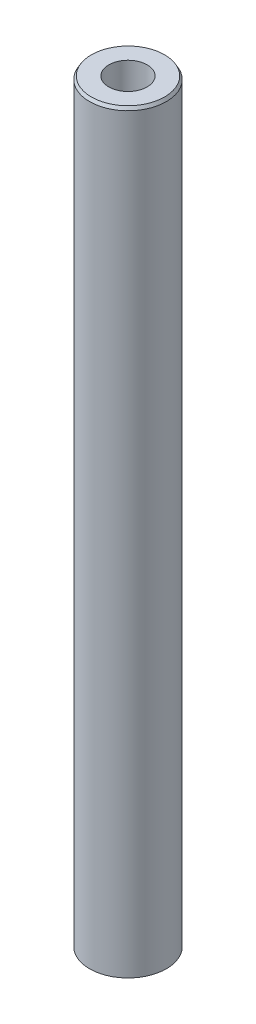
from build123d import *
from OCP.BRepFilletAPI import BRepFilletAPI_MakeChamfer

# Parameters (mm, degrees)
SKETCH1_R           = 7.5
BOSS_EXTRUDE1_DEPTH = 147.724730706
SKETCH2_R           = 3.747713612
CUT_EXTRUDE1_DEPTH  = 149.105017006
CHAMFER1_SIZE       = 0.605840418
CHAMFER1_SIZE2      = 0.349782128


with BuildPart() as part:
    # Sketch1 → Boss-Extrude1 (new body)
    with BuildSketch(Plane(origin=(0, 0, 0), x_dir=(1, 0, 0), z_dir=(0, 1, 0))):
        Circle(SKETCH1_R)
    extrude(amount=BOSS_EXTRUDE1_DEPTH)

    # Sketch2 → Cut-Extrude1 (cut, through all)
    with BuildSketch(Plane(origin=(0, 0, 0), x_dir=(1, 0, 0), z_dir=(0, 1, 0))):
        Circle(SKETCH2_R)
    extrude(amount=CUT_EXTRUDE1_DEPTH, mode=Mode.SUBTRACT)

    # Chamfer1: one chamfer whose edges measure the first distance from different faces: ONE call of the kernel's chamfer builder (chamfer() names one face for all edges)
    chamfer1_edges_1 = [part.edges().sort_by_distance(p)[0] for p in [
        (-7.5, 147.724730706, 0),
    ]]
    chamfer1_side_1 = [part.faces().sort_by_distance(p)[0] for p in [
        (-7.5, 73.862365353, 0),
    ]]
    chamfer1_edges_2 = [part.edges().sort_by_distance(p)[0] for p in [
        (-7.5, 0, 0),
    ]]
    chamfer1_side_2 = [part.faces().sort_by_distance(p)[0] for p in [
        (-7.287867966, 0, 0),
    ]]
    chamfer1 = BRepFilletAPI_MakeChamfer(part.part.solid().wrapped)
    for e in chamfer1_edges_1:
        chamfer1.Add(CHAMFER1_SIZE, CHAMFER1_SIZE2, e.wrapped, chamfer1_side_1[0].wrapped)  # the first distance lies on this face
    for e in chamfer1_edges_2:
        chamfer1.Add(CHAMFER1_SIZE, CHAMFER1_SIZE2, e.wrapped, chamfer1_side_2[0].wrapped)  # the first distance lies on this face
    add(Compound.cast(chamfer1.Shape()), mode=Mode.REPLACE)


solid = part.part
